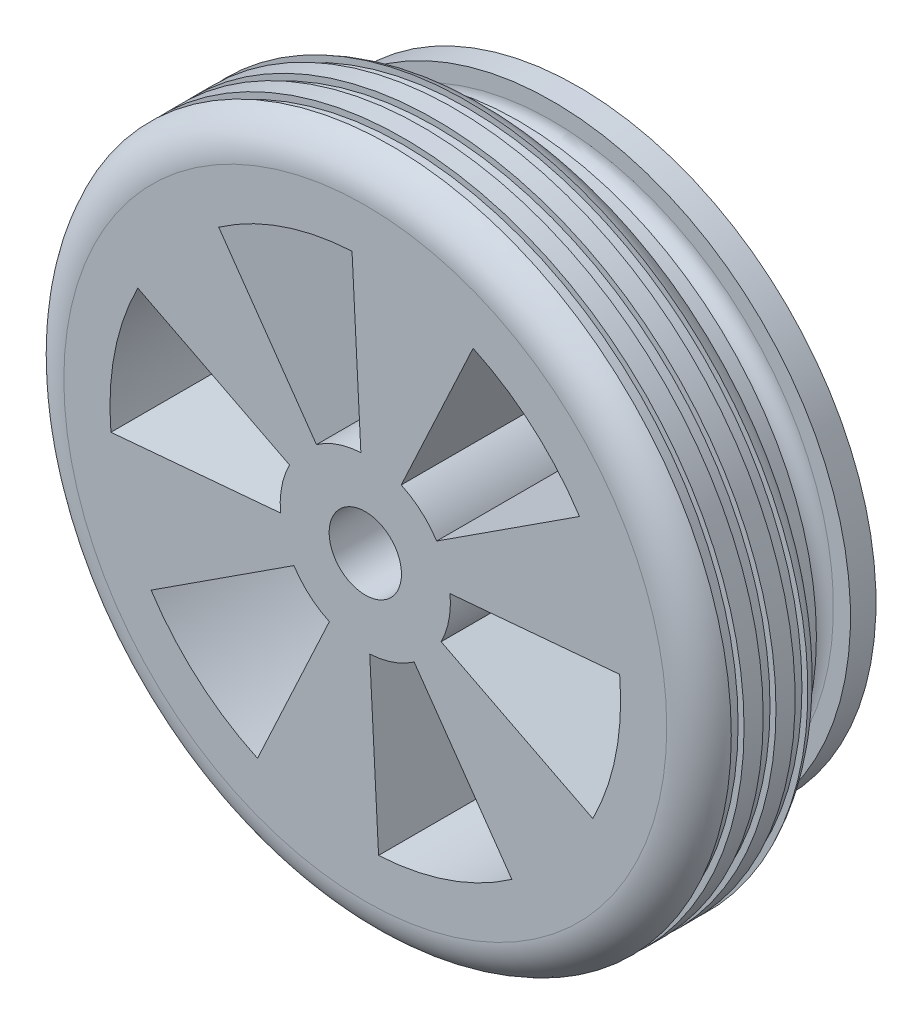
from build123d import *

# Parameters (mm, degrees)
ESQUISSE1_R                   = 40
BOSS_EXTRU_1_DEPTH            = 15
ESQUISSE2_R                   = 9.65
ENL_V_MAT_EXTRU_1_DEPTH       = 10.5
ENL_V_MAT_EXTRU_2_REACH       = 59.535
ESQUISSE3_R                   = 4.25
ENL_V_MAT_EXTRU_4_DEPTH       = 0.75
ENL_V_MAT_EXTRU_4_DEPTH_BACK  = 0.75
ESQUISSE4_R                   = 40
ESQUISSE4_R_2                 = 39.3
ENL_V_MAT_EXTRU_5_DEPTH       = 0.75
ENL_V_MAT_EXTRU_5_DEPTH_BACK  = 0.75
ESQUISSE5_R                   = 40
ESQUISSE5_R_2                 = 39.3
ENL_V_MAT_EXTRU_6_DEPTH       = 0.75
ENL_V_MAT_EXTRU_6_DEPTH_BACK  = 0.75
ESQUISSE6_R                   = 40
ESQUISSE6_R_2                 = 39.3
CONG_1_R                      = 5
ESQUISSE12_R                  = 35
BOSS_EXTRU_8_DEPTH            = 10
BOSS_EXTRU_2_START            = 10.5
ESQUISSE8_R                   = 9.65
BOSS_EXTRU_2_DEPTH            = 10.5
ENL_V_START                   = -25
ESQUISSE13_R                  = 4.25
ENL_V_MAT_EXTRU_10_DEPTH      = 25
ENL_V_MAT_EXTRU_11_DEPTH      = 25
ENL_V_MAT_EXTRU_12_DEPTH      = 2
ENL_V_MAT_EXTRU_12_DEPTH_BACK = 2
ESQUISSE16_R                  = 35
ESQUISSE16_R_2                = 31
CONG_2_R                      = 2


# Some blends are built 0.0001 mm under size
with BuildPart() as part:
    # Esquisse1 → Boss.-Extru.1 (new body)
    with BuildSketch(Plane.XY):
        Circle(ESQUISSE1_R)
    extrude(amount=BOSS_EXTRU_1_DEPTH)

    # Esquisse2 → Enlèv. mat.-Extru.1 (cut)
    with BuildSketch(Plane(origin=(0, 0, 0), x_dir=(-1, 0, 0), z_dir=(0, 0, -1))):
        Circle(ESQUISSE2_R)
    extrude(amount=-ENL_V_MAT_EXTRU_1_DEPTH, mode=Mode.SUBTRACT)

    # Esquisse3 → Enlèv. mat.-Extru.2 (cut, up to next)
    with BuildSketch(Plane(origin=(0, 0, 10.5), x_dir=(-1, 0, 0), z_dir=(0, 0, -1)), mode=Mode.PRIVATE) as enl_v_mat_extru_2_sk1:
        Circle(ESQUISSE3_R)
    enl_v_mat_extru_2_tool1 = extrude(enl_v_mat_extru_2_sk1.sketch, amount=-ENL_V_MAT_EXTRU_2_REACH, mode=Mode.PRIVATE) & part.part
    add(enl_v_mat_extru_2_tool1.solids().sort_by_distance((0, 0, 10.5))[0], mode=Mode.SUBTRACT)

    # Esquisse4 → Enlèv. mat.-Extru.4 (cut, two sides: drawn at the far end of the back side and taken through both)
    with BuildSketch(Plane.XY.offset(7.5).offset(-ENL_V_MAT_EXTRU_4_DEPTH_BACK)):
        Circle(ESQUISSE4_R)
        Circle(ESQUISSE4_R_2, mode=Mode.SUBTRACT)
    extrude(amount=ENL_V_MAT_EXTRU_4_DEPTH + ENL_V_MAT_EXTRU_4_DEPTH_BACK, mode=Mode.SUBTRACT)

    # Esquisse5 → Enlèv. mat.-Extru.5 (cut, two sides: drawn at the far end of the back side and taken through both)
    with BuildSketch(Plane.XY.offset(11.25).offset(-ENL_V_MAT_EXTRU_5_DEPTH_BACK)):
        Circle(ESQUISSE5_R)
        Circle(ESQUISSE5_R_2, mode=Mode.SUBTRACT)
    extrude(amount=ENL_V_MAT_EXTRU_5_DEPTH + ENL_V_MAT_EXTRU_5_DEPTH_BACK, mode=Mode.SUBTRACT)

    # Esquisse6 → Enlèv. mat.-Extru.6 (cut, two sides: drawn at the far end of the back side and taken through both)
    with BuildSketch(Plane(origin=(0, 0, 3.75), x_dir=(-1, 0, 0), z_dir=(0, 0, -1)).offset(-ENL_V_MAT_EXTRU_6_DEPTH_BACK)):
        Circle(ESQUISSE6_R)
        with Locations(Location((0, 0, 0), (0, 0, 180))):
            Circle(ESQUISSE6_R_2, mode=Mode.SUBTRACT)
    extrude(amount=ENL_V_MAT_EXTRU_6_DEPTH + ENL_V_MAT_EXTRU_6_DEPTH_BACK, mode=Mode.SUBTRACT)

    # Congé1
    # the kernel refuses this fillet: 5 mm, written as the material it takes off along each edge
    with BuildSketch(Plane(origin=(0, 0, 0), x_dir=(1, 0, 0), z_dir=(0, -1, 0))) as cong_1_piece_1:
        with BuildLine():
            CenterArc((35.417424305, 5), CONG_1_R, 270, 66.421821522)
            Line((35.417424305, 0), (35.417424305, -0.1))
            Line((35.417424305, -0.1), (40, -0.1))
            Line((40, -0.1), (40.1, 0))
            ThreePointArc((40.1, 0), (40.1, 1.5), (40.091651514, 2.96))
            Line((40.091651514, 2.96), (40, 3))
        make_face()
    revolve(axis=Axis((0, 0, 0), (0, 0, 1)), mode=Mode.SUBTRACT)
    with BuildSketch(Plane(origin=(0, 0, 15), x_dir=(1, 0, 0), z_dir=(0, -1, 0))) as cong_1_piece_2:
        with BuildLine():
            CenterArc((35.417424305, -5), CONG_1_R, 23.578178478, 66.421821522)
            Line((35.417424305, 0), (35.417424305, 0.1))
            Line((35.417424305, 0.1), (40, 0.1))
            Line((40, 0.1), (40.1, 0))
            ThreePointArc((40.1, 0), (40.1, -1.5), (40.091651514, -2.96))
            Line((40.091651514, -2.96), (40, -3))
        make_face()
    revolve(axis=Axis((0, 0, 15), (0, 0, 1)), mode=Mode.SUBTRACT)

    # Esquisse12 → Boss.-Extru.8 (add)
    with BuildSketch(Plane(origin=(0, 0, 0), x_dir=(-1, 0, 0), z_dir=(0, 0, -1))):
        with Locations(Location((0, 0, 0), (0, 0, 180))):
            Circle(ESQUISSE12_R)
    extrude(amount=BOSS_EXTRU_8_DEPTH)

    # Esquisse8 → Boss.-Extru.2 (add)
    with BuildSketch(Plane(origin=(0, 0, 10.5), x_dir=(-1, 0, 0), z_dir=(0, 0, -1)).offset(BOSS_EXTRU_2_START)):
        Circle(ESQUISSE8_R)
    extrude(amount=-BOSS_EXTRU_2_DEPTH)

    # Esquisse13 → Enlèv. mat.-Extru.10 (cut)
    with BuildSketch(Plane.XY.offset(15).offset(ENL_V_START)):
        with Locations(Location((0, 0, 0), (0, 0, 180))):
            Circle(ESQUISSE13_R)
    extrude(amount=ENL_V_MAT_EXTRU_10_DEPTH, mode=Mode.SUBTRACT)

    # Esquisse15 → Enlèv. mat.-Extru.11 (cut)
    with BuildSketch(Plane(origin=(0, 0, -10), x_dir=(-1, 0, 0), z_dir=(0, 0, -1))):
        with BuildLine():
            Line((-1.559164269, -29.959456049), (-0.519721423, -9.98648535))
            ThreePointArc((-0.519721423, -9.98648535), (-3.256100362, -9.455041535), (-5.739473718, -8.188921873))
            Line((-5.739473718, -8.188921873), (-17.218421153, -24.566765619))
            ThreePointArc((-17.218421153, -24.566765619), (-9.768301085, -28.365124606), (-1.559164269, -29.959456049))
        make_face()
        with BuildLine():
            Line((-26.725232157, -13.629452159), (-8.908410719, -4.54315072))
            ThreePointArc((-8.908410719, -4.54315072), (-9.816356344, -1.907655137), (-9.961551231, 0.876069107))
            Line((-9.961551231, 0.876069107), (-29.884653692, 2.628207322))
            ThreePointArc((-29.884653692, 2.628207322), (-29.449069033, -5.722965411), (-26.725232157, -13.629452159))
        make_face()
        with BuildLine():
            Line((-25.166067888, 16.330003891), (-8.388689296, 5.44333463))
            ThreePointArc((-8.388689296, 5.44333463), (-6.560255983, 7.547386398), (-4.222077513, 9.06499098))
            Line((-4.222077513, 9.06499098), (-12.666232538, 27.194972941))
            ThreePointArc((-12.666232538, 27.194972941), (-19.680767948, 22.642159195), (-25.166067888, 16.330003891))
        make_face()
        with BuildLine():
            Line((1.559164269, 29.959456049), (0.519721423, 9.98648535))
            ThreePointArc((0.519721423, 9.98648535), (3.256100362, 9.455041535), (5.739473718, 8.188921873))
            Line((5.739473718, 8.188921873), (17.218421153, 24.566765619))
            ThreePointArc((17.218421153, 24.566765619), (9.768301085, 28.365124606), (1.559164269, 29.959456049))
        make_face()
        with BuildLine():
            Line((26.725232157, 13.629452159), (8.908410719, 4.54315072))
            ThreePointArc((8.908410719, 4.54315072), (9.816356344, 1.907655137), (9.961551231, -0.876069107))
            Line((9.961551231, -0.876069107), (29.884653692, -2.628207322))
            ThreePointArc((29.884653692, -2.628207322), (29.449069033, 5.722965411), (26.725232157, 13.629452159))
        make_face()
        with BuildLine():
            Line((25.166067888, -16.330003891), (8.388689296, -5.44333463))
            ThreePointArc((8.388689296, -5.44333463), (6.560255983, -7.547386398), (4.222077513, -9.06499098))
            Line((4.222077513, -9.06499098), (12.666232538, -27.194972941))
            ThreePointArc((12.666232538, -27.194972941), (19.680767948, -22.642159195), (25.166067888, -16.330003891))
        make_face()
    extrude(amount=-ENL_V_MAT_EXTRU_11_DEPTH, mode=Mode.SUBTRACT)

    # Esquisse16 → Enlèv. mat.-Extru.12 (cut, two sides: drawn at the far end of the back side and taken through both)
    with BuildSketch(Plane(origin=(0, 0, -5), x_dir=(-1, 0, 0), z_dir=(0, 0, -1)).offset(-ENL_V_MAT_EXTRU_12_DEPTH_BACK)):
        with Locations(Location((0, 0, 0), (0, 0, 180))):
            Circle(ESQUISSE16_R)
        Circle(ESQUISSE16_R_2, mode=Mode.SUBTRACT)
    extrude(amount=ENL_V_MAT_EXTRU_12_DEPTH + ENL_V_MAT_EXTRU_12_DEPTH_BACK, mode=Mode.SUBTRACT)

    # Congé2
    cong_2_edges = [part.edges().sort_by_distance(p)[0] for p in [
        (31, 0, -7),
        (31, 0, -3),
    ]]
    fillet(cong_2_edges, radius=CONG_2_R - 0.0001)  # a hair under: the kernel refuses the full size


solid = part.part
